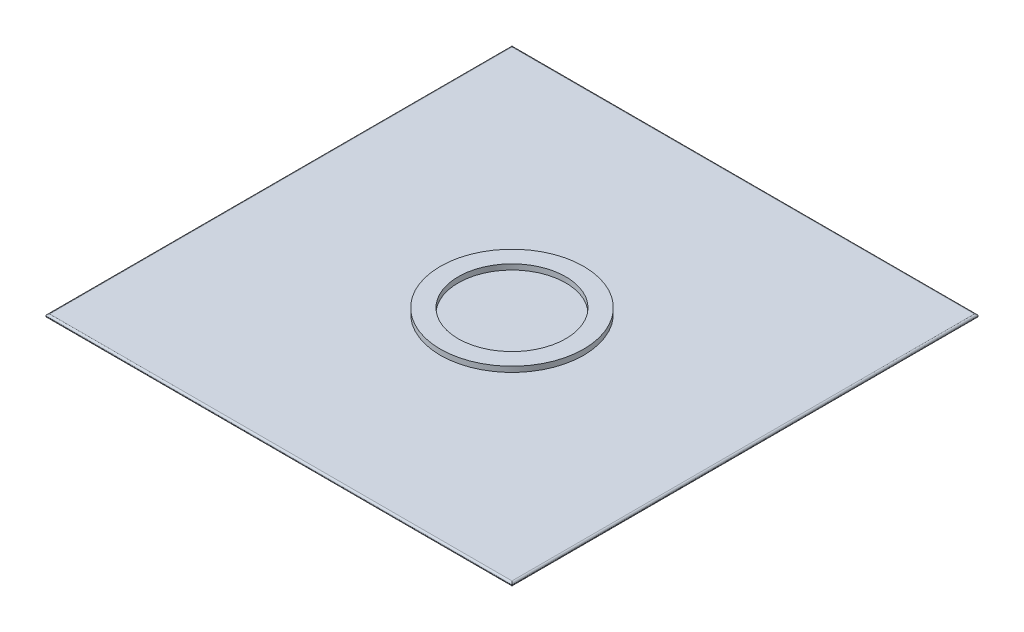
from build123d import *

# Parameters (mm, degrees)
SKETCH1_W           = 2600
SKETCH1_H           = 2600
BOSS_EXTRUDE1_DEPTH = 20
FILLET1_R           = 10
FILLET2_R           = 10
SKETCH6_W           = 100
SKETCH6_H           = 30


with BuildPart() as part:
    # Sketch1 → Boss-Extrude1 (new body)
    with BuildSketch(Plane(origin=(0, 0, 0), x_dir=(1, 0, 0), z_dir=(0, 1, 0))):
        with Locations((1300, 1300)):
            Rectangle(SKETCH1_W, SKETCH1_H)
    extrude(amount=BOSS_EXTRUDE1_DEPTH)

    # Fillet1
    fillet1_edges = [part.edges().sort_by_distance(p)[0] for p in [
        (2600, 20, -1300),
        (1300, 20, -2600),
        (0, 20, -1300),
        (1300, 20, 0),
    ]]
    fillet(fillet1_edges, radius=FILLET1_R)

    # Fillet2
    fillet2_edges = [part.edges().sort_by_distance(p)[0] for p in [
        (1300, 0, 0),
        (2600, 0, -1300),
        (1300, 0, -2600),
        (0, 0, -1300),
    ]]
    fillet(fillet2_edges, radius=FILLET2_R - 0.0001)  # a hair under: the kernel refuses the full size


with BuildPart() as body_2:
    # Sketch6 → Revolve1 (revolve)
    with BuildSketch(Plane(origin=(0, 0, -1300), x_dir=(-1, 0, 0), z_dir=(0, 0, -1)), mode=Mode.PRIVATE) as revolve1_sk:
        with Locations((-950, 35)):
            Rectangle(SKETCH6_W, SKETCH6_H)
    revolve(revolve1_sk.sketch.rotate(Axis((1300, 325.555450853, -1300), (0, -1, 0)), 270), axis=Axis((1300, 325.555450853, -1300), (0, -1, 0)))


solid = Compound([part.part, body_2.part])
